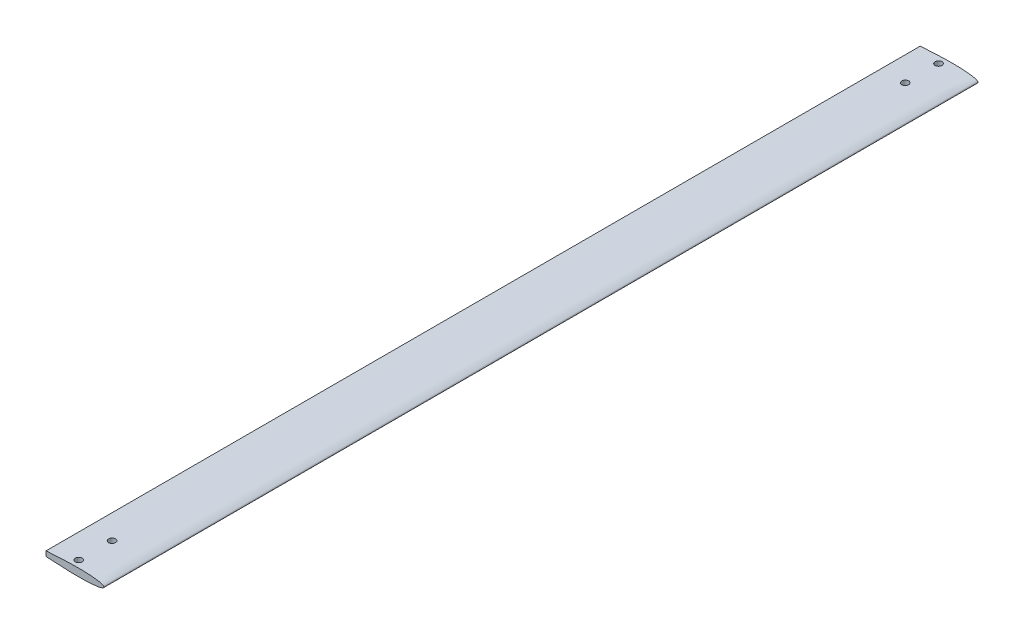
from build123d import *

# Parameters (mm, degrees)
BOSS_EXTRUDE1_DEPTH = 458.7
SKETCH2_R           = 3.6
CUT_EXTRUDE1_DEPTH  = 20


with BuildPart() as part:
    # Sketch1 → Boss-Extrude1 (new, symmetric)
    with BuildSketch(Plane.XY):
        with BuildLine():
            Line((-60.70972, 2.578861903), (-60.70972, -2.578861903))
            add(Edge.make_bspline(
                [(-60.70972, 2.578861903), (-59.951142663, 2.63310378), (-57.68878507, 2.794873079), (-53.887519983, 3.039831474), (-49.289511187, 3.311718467), (-44.640442249, 3.551385765), (-39.99133327, 3.751654566), (-35.393054883, 3.903419256), (-30.89595441, 3.99864919), (-26.549256733, 4.030219982), (-22.400539048, 3.992629586), (-18.495191761, 3.882440661), (-14.875927897, 3.698602837), (-11.582191285, 3.442730202), (-8.649904713, 3.118643407), (-6.110046561, 2.733347577), (-3.990343785, 2.292841323), (-2.30631449, 1.812264239), (-1.07597573, 1.284625355), (-0.25634726, 0.739507487), (0.10598097, 0), (-0.25634726, -0.739507487), (-1.07597573, -1.284625355), (-2.30631449, -1.812264239), (-3.990343785, -2.292841323), (-6.110046561, -2.733347577), (-8.649904713, -3.118643407), (-11.582191285, -3.442730202), (-14.875927897, -3.698602837), (-18.495191761, -3.882440661), (-22.400539048, -3.992629586), (-26.549256733, -4.030219982), (-30.89595441, -3.99864919), (-35.393054883, -3.903419256), (-39.99133327, -3.751654566), (-44.640442249, -3.551385765), (-49.289511187, -3.311718467), (-53.887519983, -3.039831474), (-57.68878507, -2.794873079), (-59.951142663, -2.63310378), (-60.70972, -2.578861903)],
                knots=[0, 0, 0, 0, 0.018499199, 0.055171439, 0.092655195, 0.130538861, 0.168407204, 0.205846372, 0.242448967, 0.277819055, 0.311576982, 0.343363918, 0.372846133, 0.39971914, 0.423712133, 0.444593591, 0.462180115, 0.476353861, 0.487105625, 0.494669113, 0.5, 0.505330887, 0.512894375, 0.523646139, 0.537819885, 0.555406409, 0.576287867, 0.60028086, 0.627153867, 0.656636082, 0.688423018, 0.722180945, 0.757551033, 0.794153628, 0.831592796, 0.869461139, 0.907344805, 0.944828561, 0.981500801, 1, 1, 1, 1], degree=3))
        make_face()
    extrude(amount=BOSS_EXTRUDE1_DEPTH, both=True)

    # Sketch2 → Cut-Extrude1 (cut)
    with BuildSketch(Plane(origin=(0, -10, 0), x_dir=(1, 0, 0), z_dir=(0, 1, 0))):
        with Locations((-33.9, -451.2)):
            Circle(SKETCH2_R)
        with Locations((-33.9, -416.2)):
            Circle(SKETCH2_R)
        with Locations((-33.9, 416.2)):
            Circle(SKETCH2_R)
        with Locations((-33.9, 451.2)):
            Circle(SKETCH2_R)
    extrude(amount=CUT_EXTRUDE1_DEPTH, mode=Mode.SUBTRACT)


solid = part.part
